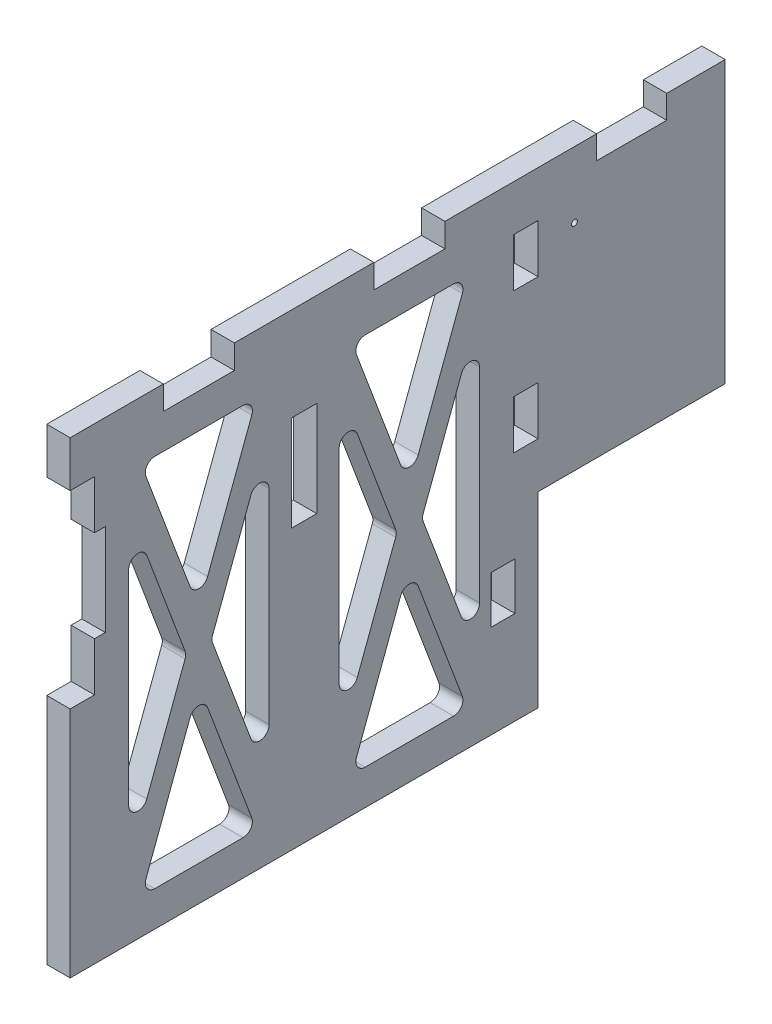
from build123d import *

# Parameters (mm, degrees)
SKETCH4_W               = 6.5024
SKETCH4_H               = 12.8524
SKETCH4_W_2             = 6.858
SKETCH4_H_2             = 25.908
BOSS_EXTRUDE1_DEPTH     = 6.35
CUT_EXTRUDE1_DEPTH      = 143.132235964
FILLET1_R               = 2.54
BOSS_EXTRUDE2_DEPTH     = 6.35
SKETCH8_R               = 0.79375
CUT_EXTRUDE2_DEPTH      = 171.978982627
CUT_EXTRUDE3_DEPTH      = 171.978982627
CUT_EXTRUDE3_DEPTH_BACK = 171.978982627
SKETCH9_W               = 9.525
SKETCH9_H               = 24.892


with BuildPart() as part:
    # Sketch4 → Boss-Extrude1 (new body)
    with BuildSketch(Plane(origin=(0, 0, 0), x_dir=(0, 0, -1), z_dir=(1, 0, 0))):
        Polygon((-63.5, 0), (-3.175, 0), (3.175, 0), (63.5, 0), (63.5, 9.824186644), (63.5, 63.246), (56.896, 63.246), (56.896, 76.454), (63.5, 76.454), (63.5, 101.346), (56.896, 101.346), (56.896, 114.554), (63.5, 114.554), (63.5, 127), (38.227, 127), (38.227, 120.523), (18.923, 120.523), (18.923, 127), (-18.923, 127), (-18.923, 120.523), (-38.227, 120.523), (-38.227, 127), (-63.5, 127), (-63.5, 114.554), (-56.896, 114.554), (-56.896, 101.346), (-63.5, 101.346), (-63.5, 76.454), (-56.896, 76.454), (-56.896, 63.246), (-63.5, 63.246), (-63.5, 3.474186644), align=None)
        with Locations((53.975, 31.75)):
            Rectangle(SKETCH4_W, SKETCH4_H, mode=Mode.SUBTRACT)
        with Locations((0, 88.646)):
            Rectangle(SKETCH4_W_2, SKETCH4_H_2, mode=Mode.SUBTRACT)
    extrude(amount=BOSS_EXTRUDE1_DEPTH)

    # Sketch5 → Cut-Extrude1 (cut, through all)
    with BuildSketch(Plane(origin=(6.35, 0, 0), x_dir=(0, 0, -1), z_dir=(1, 0, 0))):
        Polygon((-12.915901486, 111.125), (-44.234098514, 111.125), (-28.575, 69.367403964), align=None)
        Polygon((-31.965901486, 60.325), (-47.625, 102.082596036), (-47.625, 18.567403964), align=None)
        Polygon((-9.525, 102.082596036), (-25.184098514, 60.325), (-9.525, 18.567403964), align=None)
        Polygon((-12.915901486, 9.525), (-28.575, 51.282596036), (-44.234098514, 9.525), align=None)
        Polygon((44.234098514, 111.125), (12.915901486, 111.125), (28.575, 69.367403964), align=None)
        Polygon((25.184098514, 60.325), (9.525, 102.082596036), (9.525, 18.567403964), align=None)
        Polygon((47.625, 102.082596036), (31.965901486, 60.325), (47.625, 18.567403964), align=None)
        Polygon((44.234098514, 9.525), (28.575, 51.282596036), (12.915901486, 9.525), align=None)
    extrude(amount=-CUT_EXTRUDE1_DEPTH, mode=Mode.SUBTRACT)

    # Fillet1
    fillet1_edges = [part.edges().sort_by_distance(p)[0] for p in [
        (3.175, 51.282596036, 28.575),
        (3.175, 9.525, 12.915901486),
        (3.175, 9.525, 44.234098514),
        (3.175, 102.082596036, 9.525),
        (3.175, 18.567403964, 9.525),
        (3.175, 60.325, 25.184098514),
        (3.175, 51.282596036, -28.575),
        (3.175, 9.525, -44.234098514),
        (3.175, 9.525, -12.915901486),
        (3.175, 60.325, -31.965901486),
        (3.175, 102.082596036, -47.625),
        (3.175, 18.567403964, -47.625),
        (3.175, 60.325, 31.965901486),
        (3.175, 18.567403964, 47.625),
        (3.175, 102.082596036, 47.625),
        (3.175, 111.125, -12.915901486),
        (3.175, 111.125, -44.234098514),
        (3.175, 69.367403964, -28.575),
        (3.175, 111.125, 12.915901486),
        (3.175, 69.367403964, 28.575),
        (3.175, 102.082596036, -9.525),
        (3.175, 60.325, -25.184098514),
        (3.175, 18.567403964, -9.525),
        (3.175, 111.125, 44.234098514),
    ]]
    fillet(fillet1_edges, radius=FILLET1_R)

    # Sketch7 → Boss-Extrude2 (add)
    with BuildSketch(Plane.ZY):
        Polygon((-63.5, 50.8), (-63.5, 127), (-79.375, 127), (-79.375, 120.65), (-98.425, 120.65), (-98.425, 127), (-114.3, 127), (-114.3, 50.8), align=None)
    extrude(amount=-BOSS_EXTRUDE2_DEPTH)

    # Sketch8 → Cut-Extrude2 (cut, through all)
    with BuildSketch(Plane(origin=(6.35, 0, 0), x_dir=(0, 0, -1), z_dir=(1, 0, 0))):
        with Locations((73.370002403, 109.091777402)):
            Circle(SKETCH8_R)
    extrude(amount=-CUT_EXTRUDE2_DEPTH, mode=Mode.SUBTRACT)

    # Sketch9 → Cut-Extrude3 (cut, two sides: drawn at the far end of the back side and taken through both)
    with BuildSketch(Plane(origin=(6.35, 0, 0), x_dir=(0, 0, -1), z_dir=(1, 0, 0)).offset(-CUT_EXTRUDE3_DEPTH_BACK)):
        with Locations((-58.7375, 88.9)):
            Rectangle(SKETCH9_W, SKETCH9_H)
    extrude(amount=CUT_EXTRUDE3_DEPTH + CUT_EXTRUDE3_DEPTH_BACK, mode=Mode.SUBTRACT)


solid = part.part
